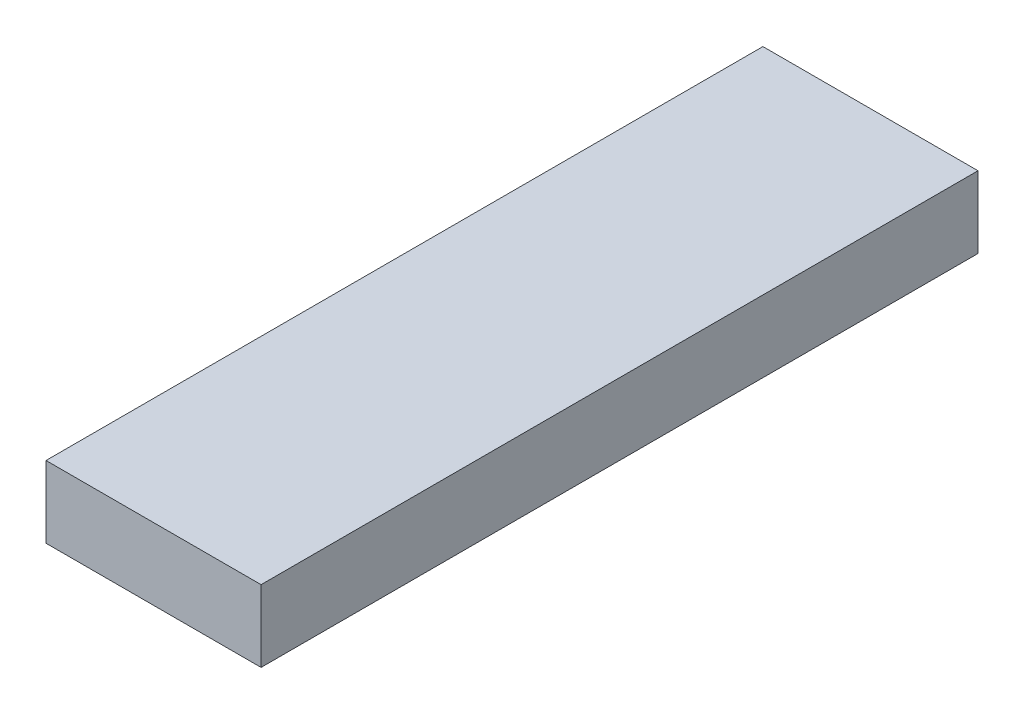
from build123d import *

# Parameters (mm, degrees)
SKETCH1_W           = 30
SKETCH1_H           = 100
BOSS_EXTRUDE1_DEPTH = 10


with BuildPart() as part:
    # Sketch1 → Boss-Extrude1 (new body)
    with BuildSketch(Plane(origin=(0, 0, 0), x_dir=(1, 0, 0), z_dir=(0, 1, 0))):
        with Locations((15, 50)):
            Rectangle(SKETCH1_W, SKETCH1_H)
    extrude(amount=BOSS_EXTRUDE1_DEPTH)


solid = part.part
